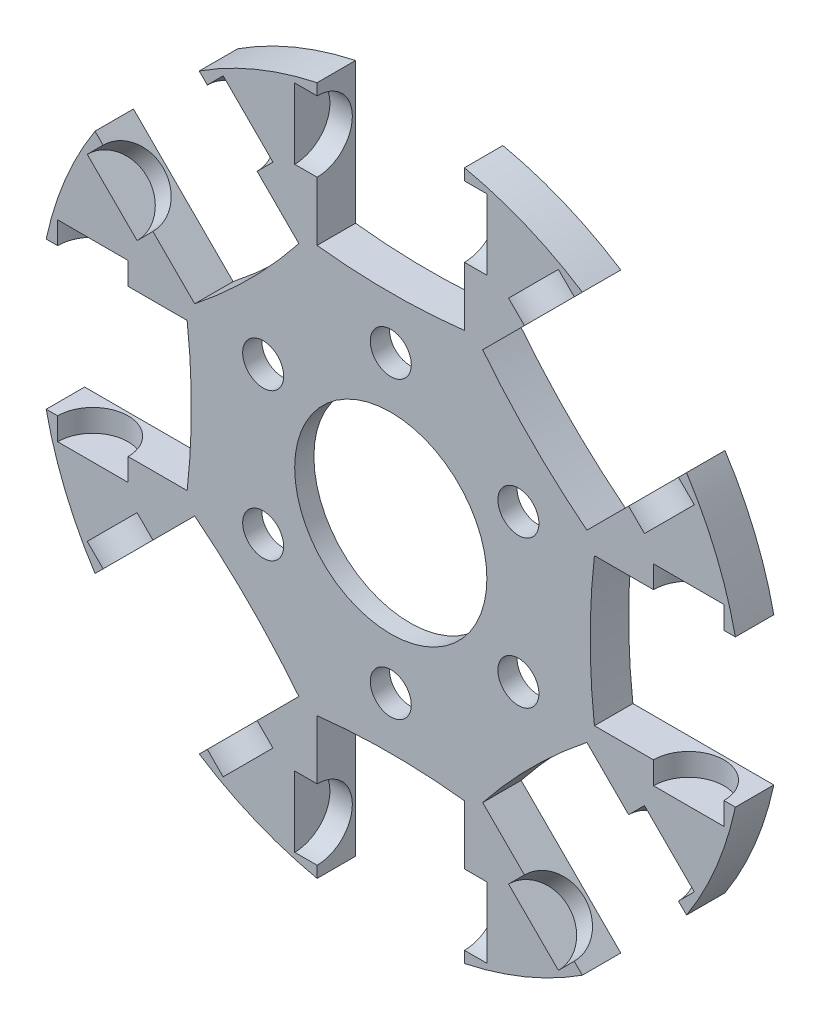
from build123d import *

# Parameters (mm, degrees)
SKETCH2_R           = 1.6
SKETCH2_R_2         = 7.5
BOSS_EXTRUDE2_DEPTH = 3
SKETCH2_4_R         = 14
SKETCH2_4_R_2       = 1.6
SKETCH2_4_R_3       = 7.5
BOSS_EXTRUDE3_DEPTH = 3
SKETCH3_W           = 15
SKETCH3_H           = 2.75
SKETCH5_R           = 15.5
CUT_EXTRUDE2_DEPTH  = 1.5
CIRPATTERN2_COUNT   = 8


with BuildPart() as part:
    # Sketch2 → Boss-Extrude2 (new body)
    with BuildSketch(Plane.XY):
        with BuildLine():
            Line((-5.75, 15.892145693), (-5.75, 26.892145693))
            ThreePointArc((-5.75, 26.892145693), (-10.52379439, 25.406687144), (-14.949754589, 23.081482572))
            Line((-14.949754589, 23.081482572), (-7.171579996, 15.303307979))
            ThreePointArc((-7.171579996, 15.303307979), (-11.002878695, 11.002878695), (-15.303307979, 7.171579996))
            Line((-15.303307979, 7.171579996), (-23.081482572, 14.949754589))
            ThreePointArc((-23.081482572, 14.949754589), (-25.406687144, 10.52379439), (-26.892145693, 5.75))
            Line((-26.892145693, 5.75), (-15.892145693, 5.75))
            ThreePointArc((-15.892145693, 5.75), (-15.560420276, 0), (-15.892145693, -5.75))
            Line((-15.892145693, -5.75), (-26.892145693, -5.75))
            ThreePointArc((-26.892145693, -5.75), (-25.406687144, -10.52379439), (-23.081482572, -14.949754589))
            Line((-23.081482572, -14.949754589), (-15.303307979, -7.171579996))
            ThreePointArc((-15.303307979, -7.171579996), (-11.002878695, -11.002878695), (-7.171579996, -15.303307979))
            Line((-7.171579996, -15.303307979), (-14.949754589, -23.081482572))
            ThreePointArc((-14.949754589, -23.081482572), (-10.52379439, -25.406687144), (-5.75, -26.892145693))
            Line((-5.75, -26.892145693), (-5.75, -15.892145693))
            ThreePointArc((-5.75, -15.892145693), (0, -15.560420276), (5.75, -15.892145693))
            Line((5.75, -15.892145693), (5.75, -26.892145693))
            ThreePointArc((5.75, -26.892145693), (10.52379439, -25.406687144), (14.949754589, -23.081482572))
            Line((14.949754589, -23.081482572), (7.171579996, -15.303307979))
            ThreePointArc((7.171579996, -15.303307979), (11.002878695, -11.002878695), (15.303307979, -7.171579996))
            Line((15.303307979, -7.171579996), (23.081482572, -14.949754589))
            ThreePointArc((23.081482572, -14.949754589), (25.406687144, -10.52379439), (26.892145693, -5.75))
            Line((26.892145693, -5.75), (15.892145693, -5.75))
            ThreePointArc((15.892145693, -5.75), (15.560420276, 0), (15.892145693, 5.75))
            Line((15.892145693, 5.75), (26.892145693, 5.75))
            ThreePointArc((26.892145693, 5.75), (25.406687144, 10.52379439), (23.081482572, 14.949754589))
            Line((23.081482572, 14.949754589), (15.303307979, 7.171579996))
            ThreePointArc((15.303307979, 7.171579996), (11.002878695, 11.002878695), (7.171579996, 15.303307979))
            Line((7.171579996, 15.303307979), (14.949754589, 23.081482572))
            ThreePointArc((14.949754589, 23.081482572), (10.52379439, 25.406687144), (5.75, 26.892145693))
            Line((5.75, 26.892145693), (5.75, 15.892145693))
            ThreePointArc((5.75, 15.892145693), (0, 15.560420276), (-5.75, 15.892145693))
        make_face()
        with Locations((0, 11.5)):
            Circle(SKETCH2_R, mode=Mode.SUBTRACT)
        with Locations((-9.959292144, -5.75)):
            Circle(SKETCH2_R, mode=Mode.SUBTRACT)
        with Locations((0, -11.5)):
            Circle(SKETCH2_R, mode=Mode.SUBTRACT)
        with Locations((9.959292144, -5.75)):
            Circle(SKETCH2_R, mode=Mode.SUBTRACT)
        with Locations((-9.959292144, 5.75)):
            Circle(SKETCH2_R, mode=Mode.SUBTRACT)
        Circle(SKETCH2_R_2, mode=Mode.SUBTRACT)
        with Locations((9.959292144, 5.75)):
            Circle(SKETCH2_R, mode=Mode.SUBTRACT)
    extrude(amount=BOSS_EXTRUDE2_DEPTH)

    # Sketch2<4> → Boss-Extrude3 (add)
    with BuildSketch(Plane.XY):
        Circle(SKETCH2_4_R)
        with Locations((-9.959292144, -5.75)):
            Circle(SKETCH2_4_R_2, mode=Mode.SUBTRACT)
        with Locations((0, -11.5)):
            Circle(SKETCH2_4_R_2, mode=Mode.SUBTRACT)
        with Locations((9.959292144, -5.75)):
            Circle(SKETCH2_4_R_2, mode=Mode.SUBTRACT)
        with Locations((-9.959292144, 5.75)):
            Circle(SKETCH2_4_R_2, mode=Mode.SUBTRACT)
        Circle(SKETCH2_4_R_3, mode=Mode.SUBTRACT)
        with Locations((9.959292144, 5.75)):
            Circle(SKETCH2_4_R_2, mode=Mode.SUBTRACT)
        with Locations((0, 11.5)):
            Circle(SKETCH2_4_R_2, mode=Mode.SUBTRACT)
    extrude(amount=BOSS_EXTRUDE3_DEPTH)

    # Sketch3 → Cut-Revolve1 (revolve, cut)
    with BuildSketch(Plane.XY.offset(3)):
        with Locations((0, 24.625)):
            Rectangle(SKETCH3_W, SKETCH3_H)
    cut_revolve1 = revolve(axis=Axis((7.5, 23.25, 3), (-1, 0, 0)), mode=Mode.SUBTRACT)

    # Sketch5 → Cut-Extrude2 (cut)
    with BuildSketch(Plane(origin=(0, 0, 0), x_dir=(-1, 0, 0), z_dir=(0, 0, -1))):
        Circle(SKETCH5_R)
    extrude(amount=-CUT_EXTRUDE2_DEPTH, mode=Mode.SUBTRACT)

    # CirPattern2: Cut-Revolve1 ×8 about axis
    cirpattern2_axis = Axis((0, 0, 3), (0, 0, 1))
    for i in range(1, CIRPATTERN2_COUNT):
        add(cut_revolve1.rotate(cirpattern2_axis, i * 360 / CIRPATTERN2_COUNT), mode=Mode.SUBTRACT)


solid = part.part
